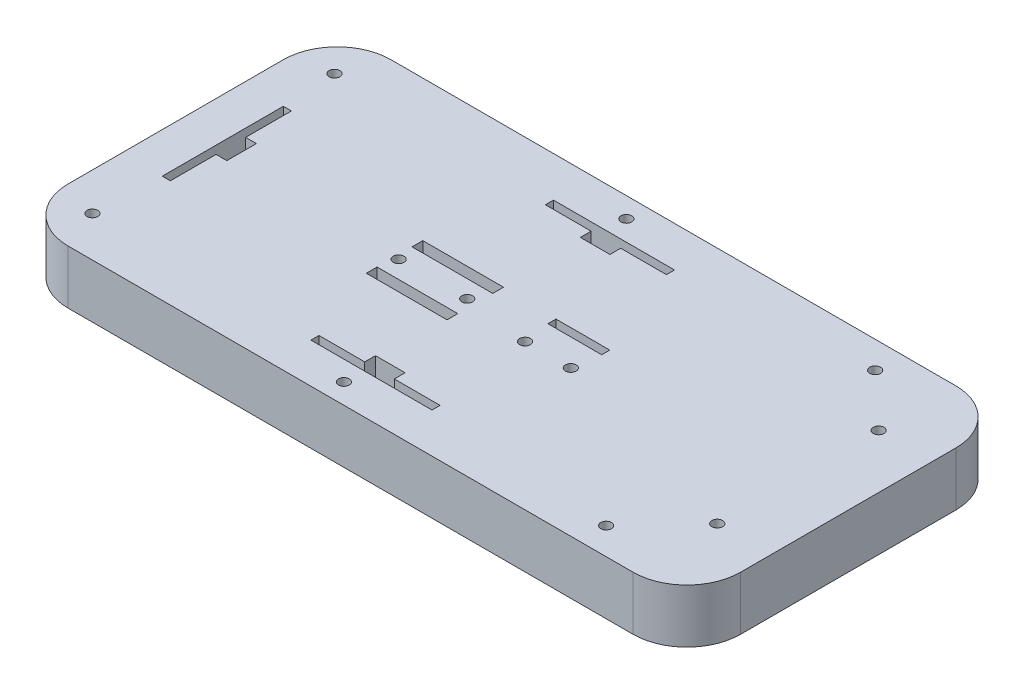
from build123d import *

# Parameters (mm, degrees)
CROQUIS1_R              = 2
CROQUIS1_W              = 20
CROQUIS1_H              = 3
CROQUIS1_W_2            = 30
CROQUIS1_H_2            = 4
SALIENTE_EXTRUIR2_DEPTH = 20
CROQUIS10_R             = 2
CORTAR_EXTRUIR5_DEPTH   = 47
CROQUIS11_R             = 2
SALIENTE_EXTRUIR5_DEPTH = 20
CROQUIS12_R             = 2
CORTAR_EXTRUIR6_DEPTH   = 48


with BuildPart() as part:
    # Croquis1 → Saliente-Extruir2 (new body)
    with BuildSketch(Plane(origin=(0, 0, 0), x_dir=(1, 0, 0), z_dir=(0, 1, 0))):
        with BuildLine():
            Line((20, 0), (230, 0))
            ThreePointArc((230, 0), (244.142135624, 5.857864376), (250, 20))
            Line((250, 20), (250, 100))
            ThreePointArc((250, 100), (244.142135624, 114.142135624), (230, 120))
            Line((230, 120), (20, 120))
            ThreePointArc((20, 120), (5.857864376, 114.142135624), (0, 100))
            Line((0, 100), (0, 20))
            ThreePointArc((0, 20), (5.857864376, 5.857864376), (20, 0))
        make_face()
        with Locations((115, 112.5)):
            Circle(CROQUIS1_R, mode=Mode.SUBTRACT)
        with Locations((115, 7.5)):
            Circle(CROQUIS1_R, mode=Mode.SUBTRACT)
        with Locations((210, 110)):
            Circle(CROQUIS1_R, mode=Mode.SUBTRACT)
        with Locations((210, 10)):
            Circle(CROQUIS1_R, mode=Mode.SUBTRACT)
        with Locations((230, 31.303267232)):
            Circle(CROQUIS1_R, mode=Mode.SUBTRACT)
        with Locations((230, 91.303267232)):
            Circle(CROQUIS1_R, mode=Mode.SUBTRACT)
        with Locations((111.177665307, 57.171940588)):
            Circle(CROQUIS1_R, mode=Mode.SUBTRACT)
        with Locations((135.677665307, 54.171940588)):
            Circle(CROQUIS1_R, mode=Mode.SUBTRACT)
        with Locations((152.677665307, 54.171940588)):
            Circle(CROQUIS1_R, mode=Mode.SUBTRACT)
        with Locations((85.677665307, 57.171940588)):
            Circle(CROQUIS1_R, mode=Mode.SUBTRACT)
        Polygon((123.413193564, 17.842204256), (140.413193564, 17.842204256), (140.413193564, 14.842204256), (95.413193564, 14.842204256), (95.413193564, 17.842204256), (112.413193564, 17.842204256), (112.413193564, 21.842204256), (123.413193564, 21.842204256), align=None, mode=Mode.SUBTRACT)
        Polygon((15, 85), (18, 85), (18, 68), (22, 68), (22, 57), (18, 57), (18, 40), (15, 40), align=None, mode=Mode.SUBTRACT)
        Polygon((95.413193564, 102), (112.413193564, 102), (112.413193564, 98), (123.413193564, 98), (123.413193564, 102), (140.413193564, 102), (140.413193564, 105), (95.413193564, 105), align=None, mode=Mode.SUBTRACT)
        with Locations((144.177665307, 65.671940588)):
            Rectangle(CROQUIS1_W, CROQUIS1_H, mode=Mode.SUBTRACT)
        with Locations((99.177665307, 65.671940588)):
            Rectangle(CROQUIS1_W_2, CROQUIS1_H_2, mode=Mode.SUBTRACT)
        with Locations((99.177665307, 48.671940588)):
            Rectangle(CROQUIS1_W_2, CROQUIS1_H_2, mode=Mode.SUBTRACT)
    extrude(amount=SALIENTE_EXTRUIR2_DEPTH)

    # Croquis10 → Cortar-Extruir5 (cut)
    with BuildSketch(Plane(origin=(0, 20, 0), x_dir=(1, 0, 0), z_dir=(0, 1, 0))):
        with Locations((20, 15)):
            Circle(CROQUIS10_R)
        with Locations((20, 105)):
            Circle(CROQUIS10_R)
    extrude(amount=-CORTAR_EXTRUIR5_DEPTH, mode=Mode.SUBTRACT)

    # Croquis11 → Saliente-Extruir5 (add)
    with BuildSketch(Plane(origin=(0, 20, 0), x_dir=(1, 0, 0), z_dir=(0, 1, 0))):
        with Locations((20, 105)):
            Circle(CROQUIS11_R)
        with Locations((20, 15)):
            Circle(CROQUIS11_R)
    extrude(amount=-SALIENTE_EXTRUIR5_DEPTH)

    # Croquis12 → Cortar-Extruir6 (cut)
    with BuildSketch(Plane(origin=(0, 20, 0), x_dir=(1, 0, 0), z_dir=(0, 1, 0))):
        with Locations((14, 15)):
            Circle(CROQUIS12_R)
        with Locations((14, 105)):
            Circle(CROQUIS12_R)
    extrude(amount=-CORTAR_EXTRUIR6_DEPTH, mode=Mode.SUBTRACT)


solid = part.part
